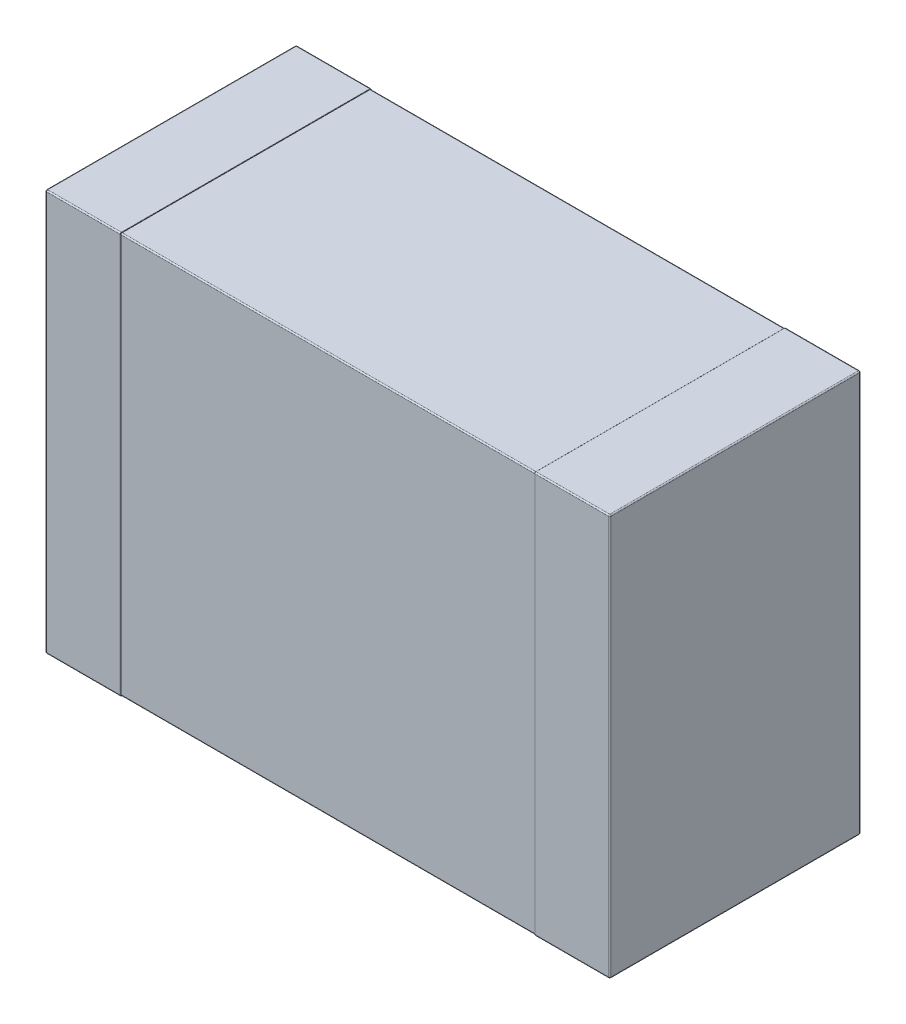
from build123d import *

# Parameters (mm, degrees)
SKETCH1_W                           = 4.5
SKETCH1_H                           = 3.2
ALL_BODY_DEPTH                      = 2
CUT_OUT_THE_BODY_FOR_PIN_DEPTH      = 1.65
CUT_OUT_THE_BODY_FOR_PIN_DEPTH_BACK = 1.65
SKETCH2_OUTSIDE_W                   = 5.174
SKETCH2_OUTSIDE_H                   = 6.374
SKETCH2_OUTSIDE_W_2                 = 1.994
SKETCH2_OUTSIDE_H_2                 = 3.194
BODY_FILLET_R                       = 0.01
PIN_FILLET_A_R                      = 0.01
PIN_FILLET_B_R                      = 0.003


with BuildPart() as part:
    # Sketch1 → All body (new body)
    with BuildSketch(Plane.XY):
        Rectangle(SKETCH1_W, SKETCH1_H)
    extrude(amount=ALL_BODY_DEPTH)

    # Sketch2 outside → Cut out the body for pin (cut, two sides: drawn at the far end of the back side and taken through both)
    with BuildSketch(Plane(origin=(0, 0, 0), x_dir=(0, 0, -1), z_dir=(1, 0, 0)).offset(-CUT_OUT_THE_BODY_FOR_PIN_DEPTH_BACK)):
        with Locations((-1, 0)):
            Rectangle(SKETCH2_OUTSIDE_W, SKETCH2_OUTSIDE_H)
        with Locations((-1, 0)):
            Rectangle(SKETCH2_OUTSIDE_W_2, SKETCH2_OUTSIDE_H_2, mode=Mode.SUBTRACT)
    extrude(amount=CUT_OUT_THE_BODY_FOR_PIN_DEPTH + CUT_OUT_THE_BODY_FOR_PIN_DEPTH_BACK, mode=Mode.SUBTRACT)

    # Body fillet
    body_fillet_edges = [part.edges().sort_by_distance(p)[0] for p in [
        (0, 1.597, 0.003),
        (0, 1.597, 1.997),
        (0, -1.597, 1.997),
        (0, -1.597, 0.003),
    ]]
    fillet(body_fillet_edges, radius=BODY_FILLET_R)

    # Pin fillet a
    pin_fillet_a_edges = [part.edges().sort_by_distance(p)[0] for p in [
        (2.25, 0, 2),
        (-1.95, 1.6, 0),
        (1.95, -1.6, 0),
        (1.95, -1.6, 2),
        (-1.95, 1.6, 2),
        (1.95, 1.6, 2),
        (-2.25, 0, 2),
        (1.95, 1.6, 0),
        (2.25, 0, 0),
        (-1.95, -1.6, 0),
        (-2.25, 0, 0),
        (-2.25, 1.6, 1),
        (2.25, 1.6, 1),
        (2.25, -1.6, 1),
        (-2.25, -1.6, 1),
        (-1.95, -1.6, 2),
    ]]
    fillet(pin_fillet_a_edges, radius=PIN_FILLET_A_R)

    # Pin fillet b
    pin_fillet_b_edges = [part.edges().sort_by_distance(p)[0] for p in [
        (1.65, -1.6, 1),
        (1.65, 0, 2),
        (1.65, 1.6, 1),
        (1.65, 0, 0),
        (-1.65, 1.6, 1),
        (-1.65, 0, 2),
        (-1.65, -1.6, 1),
        (-1.65, 0, 0),
        (1.65, 1.597071068, 0.002928932),
        (1.65, -1.597071068, 0.002928932),
        (1.65, -1.597071068, 1.997071068),
        (1.65, 1.597071068, 1.997071068),
        (-1.65, -1.597071068, 1.997071068),
        (-1.65, 1.597071068, 1.997071068),
        (-1.65, -1.597071068, 0.002928932),
        (-1.65, 1.597071068, 0.002928932),
    ]]
    fillet(pin_fillet_b_edges, radius=PIN_FILLET_B_R - 0.0001)  # a hair under: the kernel refuses the full size


solid = part.part
